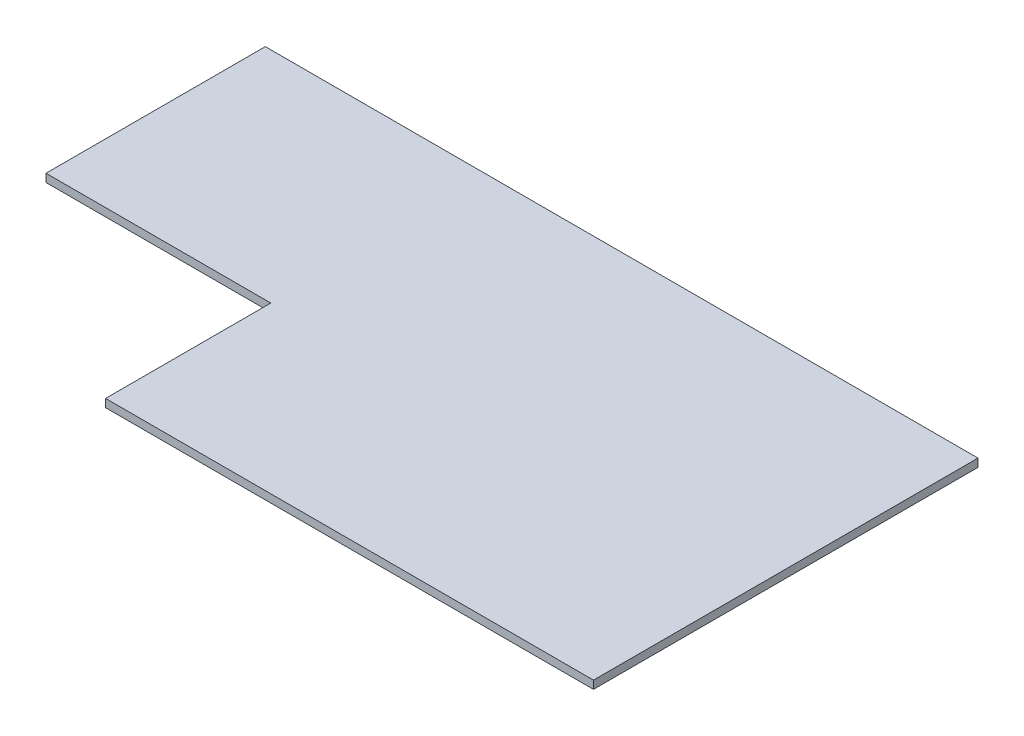
from build123d import *

# Parameters (mm, degrees)
BOSS_EXTRUDE1_DEPTH = 3.175


with BuildPart() as part:
    # Sketch1 → Boss-Extrude1 (new, symmetric)
    with BuildSketch(Plane(origin=(0, 0, 0), x_dir=(1, 0, 0), z_dir=(0, 1, 0))):
        Polygon((-94.767842446, -156.48908094), (290.042157554, -156.48908094), (290.042157554, 146.78691906), (-272.059842446, 146.78691906), (-272.059842446, -26.18708094), (-94.767842446, -26.18708094), align=None)
    extrude(amount=BOSS_EXTRUDE1_DEPTH, both=True)


solid = part.part
